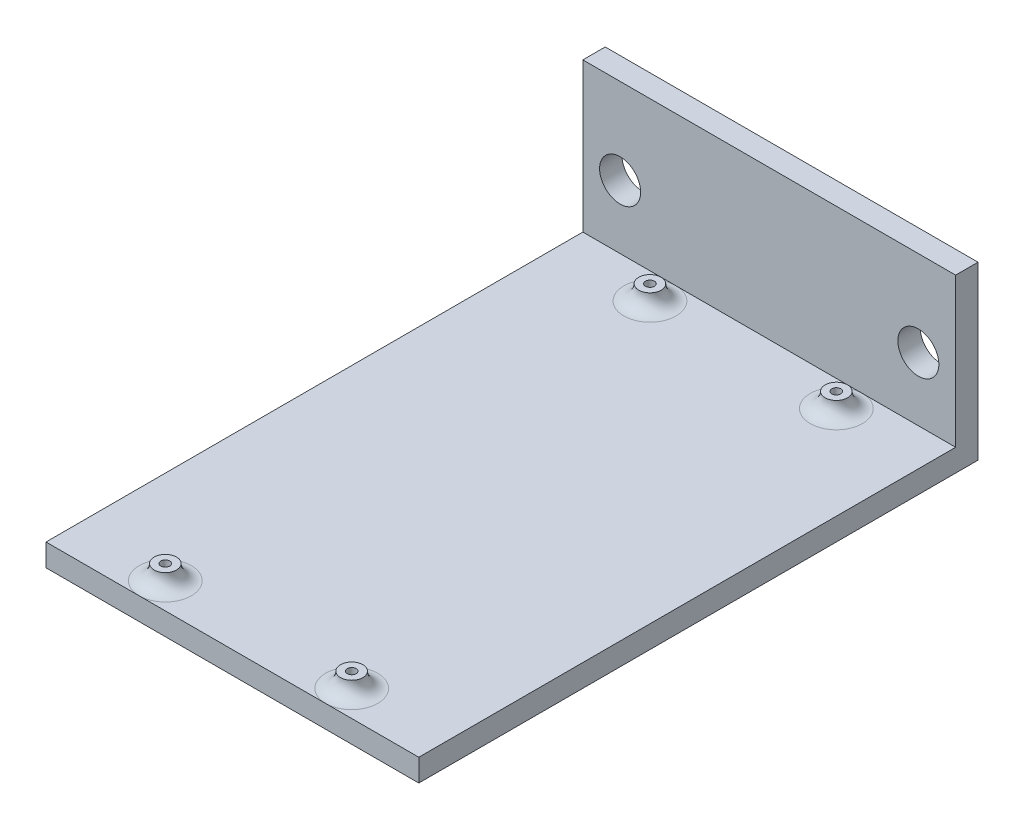
from build123d import *

# Parameters (mm, degrees)
SKETCH1_W                      = 50
SKETCH1_H                      = 75
BOSS_EXTRUDE1_DEPTH            = 3
SKETCH2_W                      = 50
SKETCH2_H                      = 3
BOSS_EXTRUDE2_DEPTH            = 20
M5_CLEARANCE_HOLE1_D           = 5.5
M5_CLEARANCE_HOLE1_ON_FACE_2_D = 5.5
SKETCH6_R                      = 1.5
BOSS_EXTRUDE3_DEPTH            = 2
CUT_EXTRUDE1_REACH             = 50.531
SKETCH7_R                      = 0.6
FILLET1_R                      = 2


with BuildPart() as part:
    # Sketch1 → Boss-Extrude1 (new body)
    with BuildSketch(Plane(origin=(0, 0, 0), x_dir=(1, 0, 0), z_dir=(0, 1, 0))):
        Rectangle(SKETCH1_W, SKETCH1_H)
    extrude(amount=BOSS_EXTRUDE1_DEPTH)

    # Sketch2 → Boss-Extrude2 (add)
    with BuildSketch(Plane(origin=(0, 3, 0), x_dir=(1, 0, 0), z_dir=(0, 1, 0))):
        with Locations((0, 36)):
            Rectangle(SKETCH2_W, SKETCH2_H)
    extrude(amount=BOSS_EXTRUDE2_DEPTH)

    # M5 Clearance Hole1 (through all)
    with Locations(Plane(origin=(20, 11.5, -37.5), x_dir=(-1, 0, 0), z_dir=(0, 0, -1))):
        with Locations((0, 0), (40, 0)):
            Hole(M5_CLEARANCE_HOLE1_D / 2)

    # M5 Clearance Hole1 on face 2 (through all)
    with Locations(Plane(origin=(-94.663434395, 64.222873605, 0), x_dir=(-1, 0, 0), z_dir=(0, 0, -1))):
        with Locations((0, 0)):
            Hole(M5_CLEARANCE_HOLE1_ON_FACE_2_D / 2)

    # Sketch6 → Boss-Extrude3 (add)
    with BuildSketch(Plane(origin=(0, 3, 0), x_dir=(1, 0, 0), z_dir=(0, 1, 0))):
        with Locations(Location((-12.5, 31, 0), (0, 0, 270))):
            Circle(SKETCH6_R)
        with Locations(Location((12.5, 31, 0), (0, 0, 270))):
            Circle(SKETCH6_R)
        with Locations(Location((12.5, -34, 0), (0, 0, 270))):
            Circle(SKETCH6_R)
        with Locations(Location((-12.5, -34, 0), (0, 0, 270))):
            Circle(SKETCH6_R)
    extrude(amount=BOSS_EXTRUDE3_DEPTH)

    # Sketch7 → Cut-Extrude1 (cut, up to next)
    with BuildSketch(Plane(origin=(0, 5, 0), x_dir=(1, 0, 0), z_dir=(0, 1, 0)), mode=Mode.PRIVATE) as cut_extrude1_sk1:
        with Locations(Location((-12.5, 31, 0), (0, 0, 270))):
            Circle(SKETCH7_R)
    cut_extrude1_tool1 = extrude(cut_extrude1_sk1.sketch, amount=-CUT_EXTRUDE1_REACH, mode=Mode.PRIVATE) & part.part
    # Sketch7 → Cut-Extrude1 (cut, up to next)
    with BuildSketch(Plane(origin=(0, 5, 0), x_dir=(1, 0, 0), z_dir=(0, 1, 0)), mode=Mode.PRIVATE) as cut_extrude1_sk2:
        with Locations(Location((12.5, 31, 0), (0, 0, 270))):
            Circle(SKETCH7_R)
    cut_extrude1_tool2 = extrude(cut_extrude1_sk2.sketch, amount=-CUT_EXTRUDE1_REACH, mode=Mode.PRIVATE) & part.part
    # Sketch7 → Cut-Extrude1 (cut, up to next)
    with BuildSketch(Plane(origin=(0, 5, 0), x_dir=(1, 0, 0), z_dir=(0, 1, 0)), mode=Mode.PRIVATE) as cut_extrude1_sk3:
        with Locations(Location((12.5, -34, 0), (0, 0, 270))):
            Circle(SKETCH7_R)
    cut_extrude1_tool3 = extrude(cut_extrude1_sk3.sketch, amount=-CUT_EXTRUDE1_REACH, mode=Mode.PRIVATE) & part.part
    # Sketch7 → Cut-Extrude1 (cut, up to next)
    with BuildSketch(Plane(origin=(0, 5, 0), x_dir=(1, 0, 0), z_dir=(0, 1, 0)), mode=Mode.PRIVATE) as cut_extrude1_sk4:
        with Locations(Location((-12.5, -34, 0), (0, 0, 270))):
            Circle(SKETCH7_R)
    cut_extrude1_tool4 = extrude(cut_extrude1_sk4.sketch, amount=-CUT_EXTRUDE1_REACH, mode=Mode.PRIVATE) & part.part
    add(cut_extrude1_tool1.solids().sort_by_distance((-12.5, 5, -31))[0], mode=Mode.SUBTRACT)
    add(cut_extrude1_tool2.solids().sort_by_distance((12.5, 5, -31))[0], mode=Mode.SUBTRACT)
    add(cut_extrude1_tool3.solids().sort_by_distance((12.5, 5, 34))[0], mode=Mode.SUBTRACT)
    add(cut_extrude1_tool4.solids().sort_by_distance((-12.5, 5, 34))[0], mode=Mode.SUBTRACT)

    # Fillet1
    fillet1_edges = [part.edges().sort_by_distance(p)[0] for p in [
        (-12.5, 3, -32.5),
        (12.5, 3, -32.5),
        (12.5, 3, 32.5),
        (-12.5, 3, 32.5),
    ]]
    fillet(fillet1_edges, radius=FILLET1_R - 0.0001)  # a hair under: the kernel refuses the full size


solid = part.part
